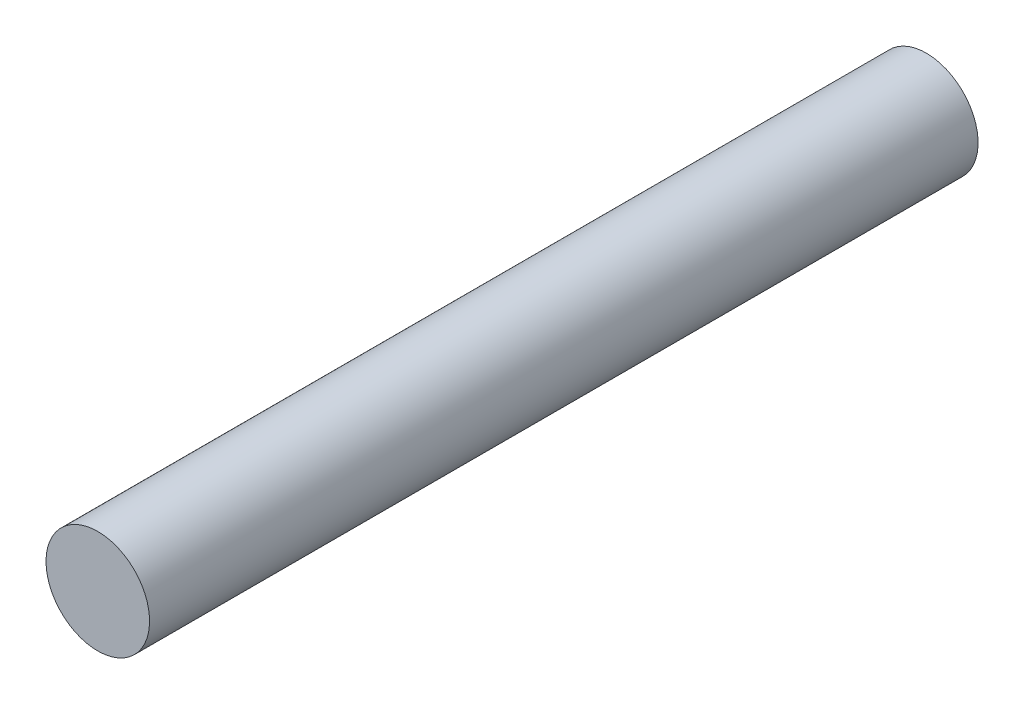
from build123d import *

# Parameters (mm, degrees)
SKETCH1_R           = 4.7625
BOSS_EXTRUDE1_DEPTH = 76.2


with BuildPart() as part:
    # Sketch1 → Boss-Extrude1 (new body)
    with BuildSketch(Plane.XY):
        Circle(SKETCH1_R)
    extrude(amount=BOSS_EXTRUDE1_DEPTH)


solid = part.part
